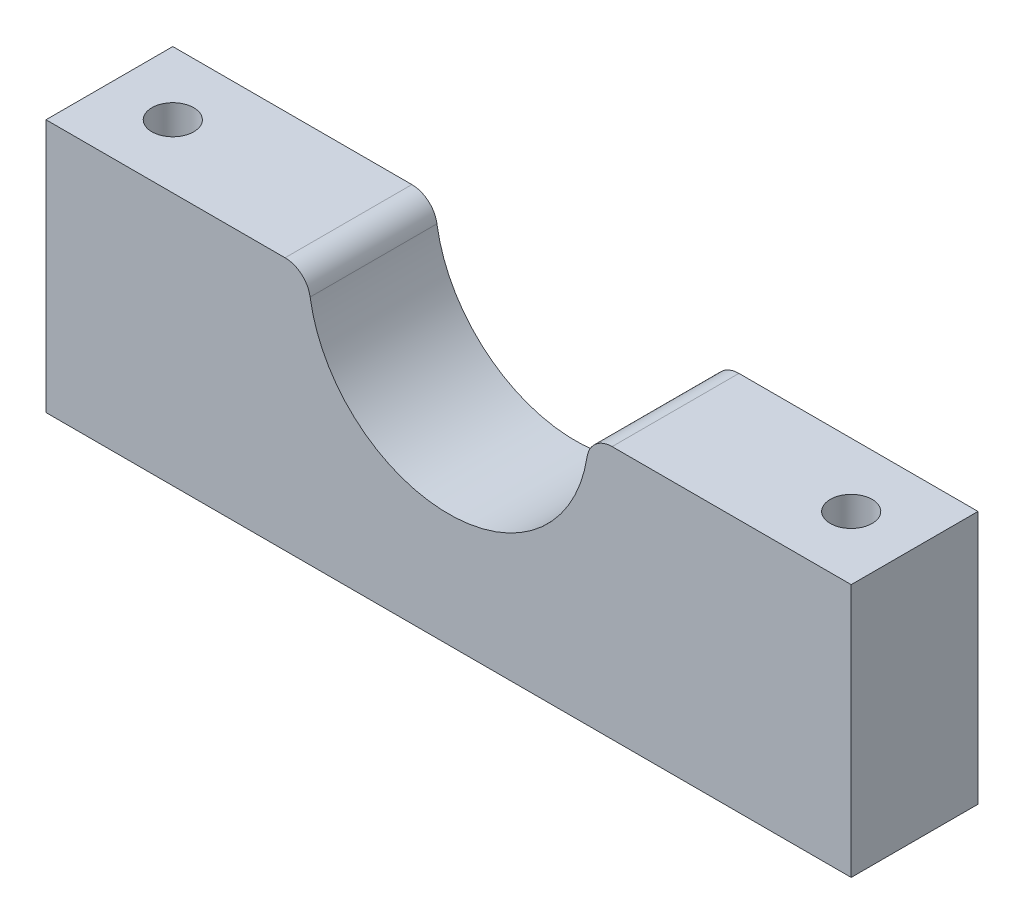
from build123d import *

# Parameters (mm, degrees)
EXTRUDE_1_DEPTH = 10
M4X0_71_D       = 3.3
FILLET_2_R      = 2


with BuildPart() as part:
    # Эскиз1 → Бобышка-Вытянуть1 (new body)
    with BuildSketch(Plane.XY):
        with BuildLine():
            Line((11.05, 0), (31.75, 0))
            Line((31.75, 0), (31.75, -20))
            Line((31.75, -20), (-31.75, -20))
            Line((-31.75, -20), (-31.75, 0))
            Line((-31.75, 0), (-11.05, 0))
            ThreePointArc((-11.05, 0), (0, -11.05), (11.05, 0))
        make_face()
    extrude(amount=EXTRUDE_1_DEPTH)

    # Отверстие обработанное метчиком M4x0.71 (through all)
    with Locations(Plane(origin=(0, -20, 0), x_dir=(-1, 0, 0), z_dir=(0, -1, 0))):
        with Locations((26.75, -5), (-26.75, -5)):
            Hole(M4X0_71_D / 2)

    # Скругление2
    fillet_2_edges = [part.edges().sort_by_distance(p)[0] for p in [
        (11.05, 0, 5),
        (-11.05, 0, 5),
    ]]
    fillet(fillet_2_edges, radius=FILLET_2_R)


solid = part.part
